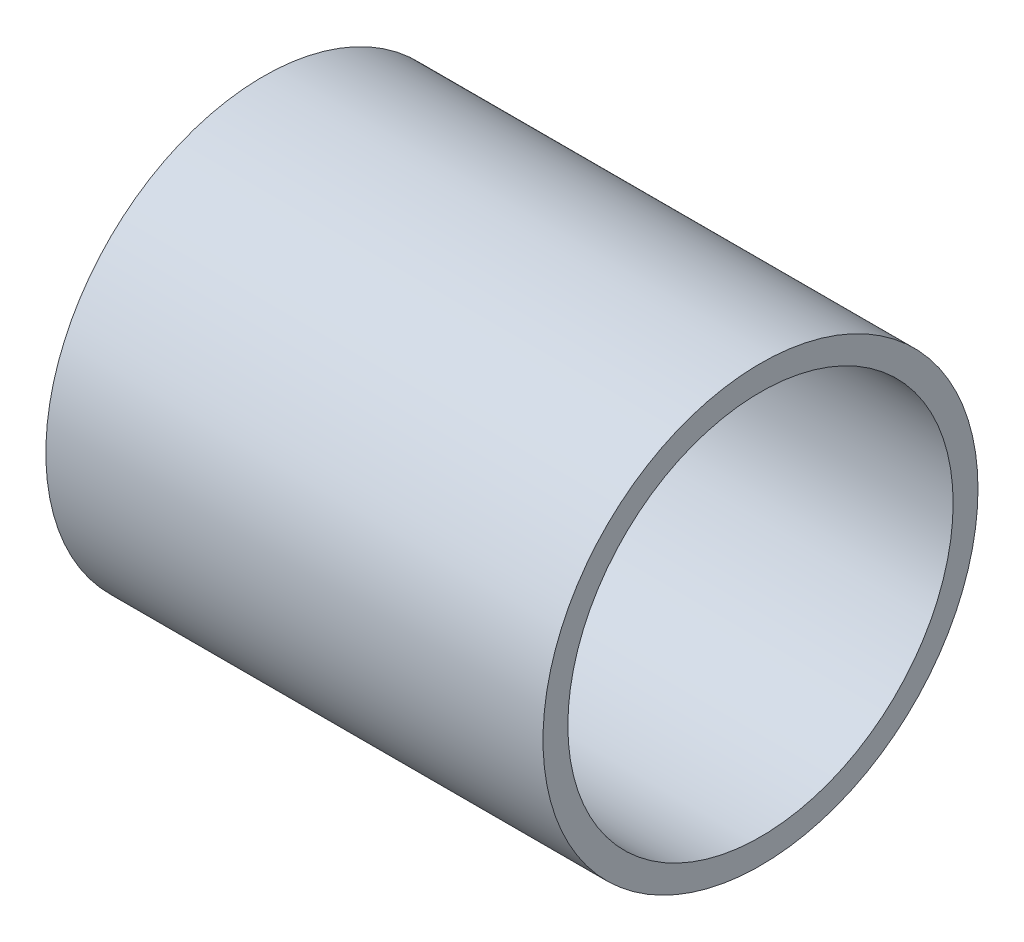
from build123d import *

# Parameters (mm, degrees)
BOSS_EXTRUDE1_START = 100
SKETCH4_R           = 17.5
SKETCH4_R_2         = 15.5
BOSS_EXTRUDE1_DEPTH = 40


with BuildPart() as part:
    # Sketch4 → Boss-Extrude1 (new body)
    with BuildSketch(Plane(origin=(0, 0, 0), x_dir=(0, 0, -1), z_dir=(1, 0, 0)).offset(BOSS_EXTRUDE1_START)):
        with Locations((0, -120.5)):
            Circle(SKETCH4_R)
        with Locations((0, -120.5)):
            Circle(SKETCH4_R_2, mode=Mode.SUBTRACT)
    extrude(amount=BOSS_EXTRUDE1_DEPTH)


solid = part.part
